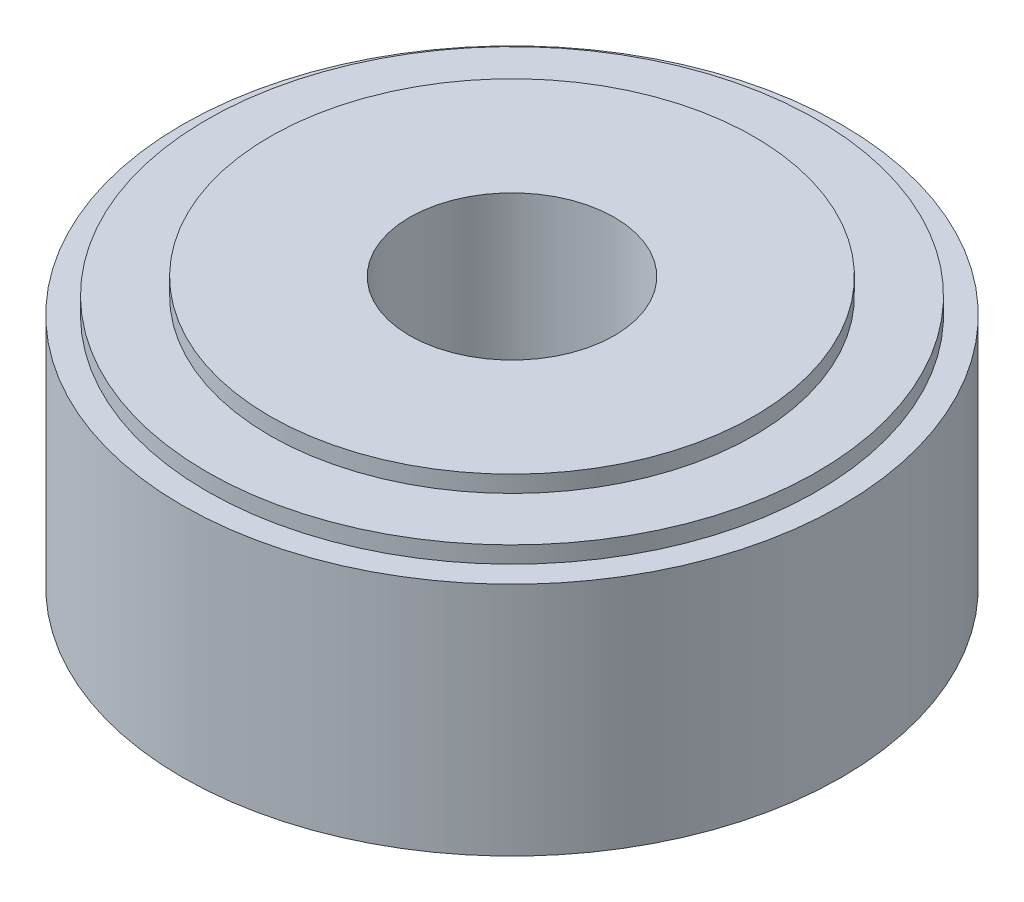
from build123d import *

# Parameters (mm, degrees)
SKETCH1_R           = 19.73
BOSS_EXTRUDE1_DEPTH = 7.045
SKETCH2_R           = 18.26
BOSS_EXTRUDE2_DEPTH = 1
SKETCH3_R           = 14.49
BOSS_EXTRUDE3_DEPTH = 1
CUT_EXTRUDE1_REACH  = 34.209
SKETCH4_R           = 6.13


with BuildPart() as part:
    # Sketch1 → Boss-Extrude1 (new, symmetric)
    with BuildSketch(Plane(origin=(0, 0, 0), x_dir=(1, 0, 0), z_dir=(0, 1, 0))):
        Circle(SKETCH1_R)
    extrude(amount=BOSS_EXTRUDE1_DEPTH, both=True)

    # Sketch2 → Boss-Extrude2 (add, symmetric)
    with BuildSketch(Plane(origin=(0, 7.045, 0), x_dir=(1, 0, 0), z_dir=(0, 1, 0))):
        Circle(SKETCH2_R)
    extrude(amount=BOSS_EXTRUDE2_DEPTH, both=True)

    # Sketch3 → Boss-Extrude3 (add, symmetric)
    with BuildSketch(Plane(origin=(0, 8.045, 0), x_dir=(1, 0, 0), z_dir=(0, 1, 0))):
        Circle(SKETCH3_R)
    extrude(amount=BOSS_EXTRUDE3_DEPTH, both=True)

    # Sketch4 → Cut-Extrude1 (cut, up to next)
    with BuildSketch(Plane(origin=(0, 9.045, 0), x_dir=(1, 0, 0), z_dir=(0, 1, 0)), mode=Mode.PRIVATE) as cut_extrude1_sk1:
        Circle(SKETCH4_R)
    cut_extrude1_tool1 = extrude(cut_extrude1_sk1.sketch, amount=-CUT_EXTRUDE1_REACH, mode=Mode.PRIVATE) & part.part
    add(cut_extrude1_tool1.solids().sort_by_distance((0, 9.045, 0))[0], mode=Mode.SUBTRACT)


solid = part.part
